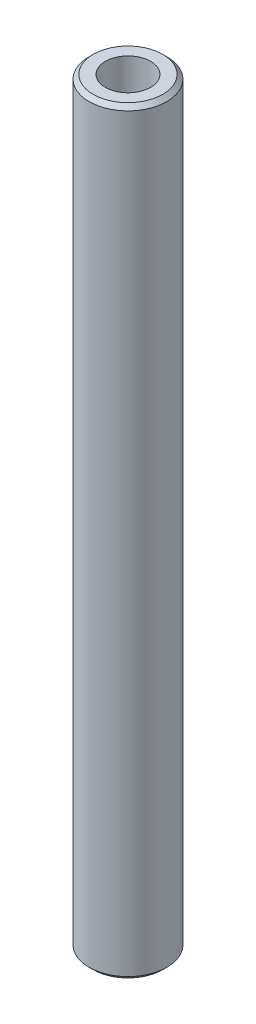
from build123d import *

# Parameters (mm, degrees)
SKETCH1_R           = 10
BOSS_EXTRUDE1_DEPTH = 194.944000668
SKETCH2_R           = 5.813555512
CUT_EXTRUDE1_DEPTH  = 196.456295362
CHAMFER1_SIZE       = 1.071737818


with BuildPart() as part:
    # Sketch1 → Boss-Extrude1 (new body)
    with BuildSketch(Plane(origin=(0, 0, 0), x_dir=(1, 0, 0), z_dir=(0, 1, 0))):
        Circle(SKETCH1_R)
    extrude(amount=BOSS_EXTRUDE1_DEPTH)

    # Sketch2 → Cut-Extrude1 (cut, through all)
    with BuildSketch(Plane(origin=(0, 0, 0), x_dir=(1, 0, 0), z_dir=(0, 1, 0))):
        Circle(SKETCH2_R)
    extrude(amount=CUT_EXTRUDE1_DEPTH, mode=Mode.SUBTRACT)

    # Chamfer1
    chamfer1_edges = [part.edges().sort_by_distance(p)[0] for p in [
        (-10, 194.944000668, 0),
        (-10, 0, 0),
    ]]
    chamfer(chamfer1_edges, length=CHAMFER1_SIZE)


solid = part.part
